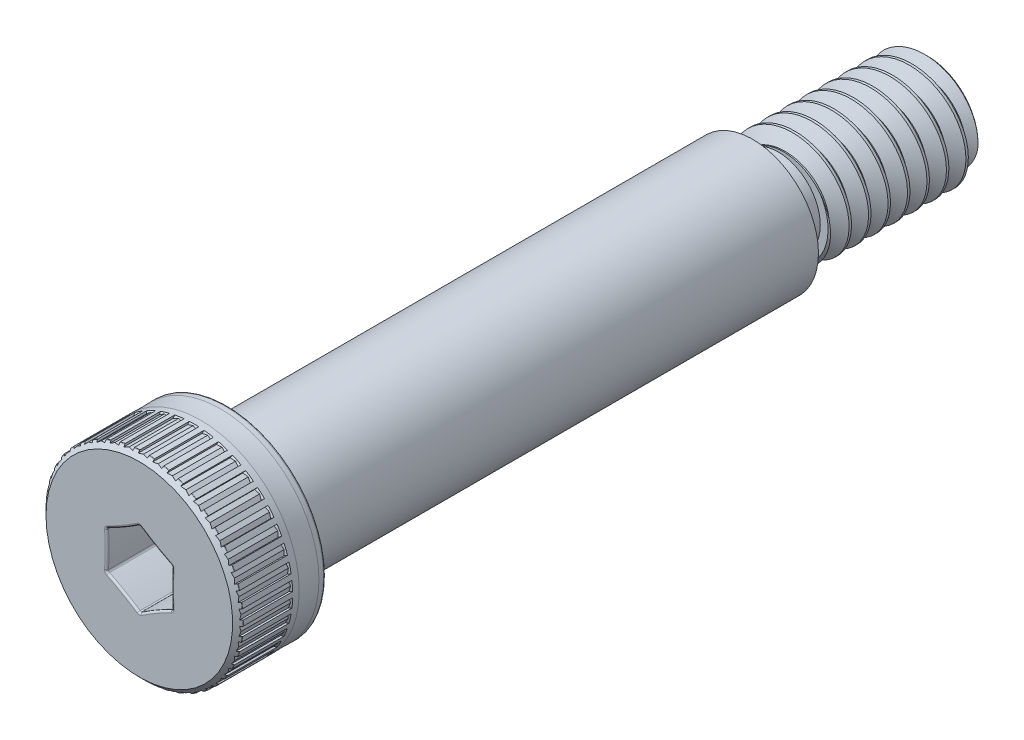
from build123d import *

# Parameters (mm, degrees)
SKETCH4_W             = 1.5875
SKETCH4_H             = 0.47625
SKETCH4_W_2           = 1.834444444
SKETCH4_H_2           = 0.916543552
CHAMFER1_SIZE         = 0.47625
FILLET1_R             = 0.28575
FILLET2_R             = 0.282222222
CHAMFER2_SIZE         = 0.352777778
CHAMFER3_SIZE         = 0.381
CUT_EXTRUDE1_DEPTH    = 3.9751
FILLET4_R             = 0.142875
DELETEFACE1_START     = -39.934444444
DELETEFACE1_OUTLINE_W = 10
DELETEFACE1_OUTLINE_H = 10
DELETEFACE1_OUTLINE_R = 3.058556448
DELETEFACE1_DEPTH     = 0.282222322
CUT_SWEEP1_PITCH      = 1.411111111
CUT_EXTRUDE2_REACH    = 60.036
CIRPATTERN1_COUNT     = 42
FILLET5_R             = 0.0508


# Read off the part's stored shape, not the designer's step: DeleteFace1, CirPattern2
with BuildPart() as part:
    # Sketch3 → Revolve1 (revolve)
    with BuildSketch(Plane(origin=(0, 0, 0), x_dir=(0, 0, -1), z_dir=(1, 0, 0)), mode=Mode.PRIVATE) as revolve1_sk:
        Polygon((-6.35, 7.14375), (0, 7.14375), (0, 4.7625), (38.1, 4.7625), (38.1, 3.9751), (50.8, 3.9751), (50.8, 0), (-6.35, 0), align=None)
    revolve(revolve1_sk.sketch.rotate(Axis((0, 0, 6.35), (0, 0, -1)), 90), axis=Axis((0, 0, 6.35), (0, 0, -1)))

    # Sketch4 → Cut-Revolve1 (revolve, cut)
    with BuildSketch(Plane(origin=(0, 0, 0), x_dir=(0, 0, -1), z_dir=(1, 0, 0)), mode=Mode.PRIVATE) as cut_revolve1_sk:
        with Locations((0.79375, 4.524375)):
            Rectangle(SKETCH4_W, SKETCH4_H)
        with Locations((39.017222222, 3.516828224)):
            Rectangle(SKETCH4_W_2, SKETCH4_H_2)
    revolve(cut_revolve1_sk.sketch.rotate(Axis((0, 0, 6.35), (0, 0, -1)), 90), axis=Axis((0, 0, 6.35), (0, 0, -1)), mode=Mode.SUBTRACT)

    # Chamfer1
    chamfer1_edges = [part.edges().sort_by_distance(p)[0] for p in [
        (-4.28625, 0, -1.5875),
    ]]
    chamfer(chamfer1_edges, length=CHAMFER1_SIZE - 0.0001)  # a hair under: the kernel refuses the full size

    # Fillet1
    fillet1_edges = [part.edges().sort_by_distance(p)[0] for p in [
        (-4.28625, 0, 0),
    ]]
    fillet(fillet1_edges, radius=FILLET1_R)

    # Fillet2
    fillet2_edges = [part.edges().sort_by_distance(p)[0] for p in [
        (-3.058556448, 0, -38.1),
        (-3.058556448, 0, -39.934444444),
    ]]
    fillet(fillet2_edges, radius=FILLET2_R)

    # Chamfer2
    chamfer2_edges = [part.edges().sort_by_distance(p)[0] for p in [
        (-3.9751, 0, -39.934444444),
        (-3.9751, 0, -50.8),
    ]]
    chamfer(chamfer2_edges, length=CHAMFER2_SIZE)

    # Chamfer3
    chamfer3_edges = [part.edges().sort_by_distance(p)[0] for p in [
        (-7.14375, 0, 6.35),
    ]]
    chamfer(chamfer3_edges, length=CHAMFER3_SIZE)

    # Sketch5 → Cut-Extrude1 (cut)
    with BuildSketch(Plane.XY.offset(6.35)):
        with BuildLine():
            ThreePointArc((2.38125, 1.374815329), (1.1668125, 2.020978533), (0, 2.749630657))
            ThreePointArc((0, 2.749630657), (-1.1668125, 2.020978533), (-2.38125, 1.374815329))
            ThreePointArc((-2.38125, 1.374815329), (-2.333625, 0), (-2.38125, -1.374815329))
            ThreePointArc((-2.38125, -1.374815329), (-1.1668125, -2.020978533), (0, -2.749630657))
            ThreePointArc((0, -2.749630657), (1.1668125, -2.020978533), (2.38125, -1.374815329))
            ThreePointArc((2.38125, -1.374815329), (2.333625, 0), (2.38125, 1.374815329))
        make_face()
    extrude(amount=-CUT_EXTRUDE1_DEPTH, mode=Mode.SUBTRACT)

    # Fillet4
    fillet4_edges = [part.edges().sort_by_distance(p)[0] for p in [
        (2.333625, 0, 2.3749),
        (2.38125, 1.374815329, 4.36245),
        (1.1668125, -2.020978533, 2.3749),
        (2.38125, -1.374815329, 4.36245),
        (-1.1668125, -2.020978533, 2.3749),
        (0, -2.749630657, 4.36245),
        (-2.333625, 0, 2.3749),
        (-2.38125, -1.374815329, 4.36245),
        (-1.1668125, 2.020978533, 2.3749),
        (-2.38125, 1.374815329, 4.36245),
        (1.1668125, 2.020978533, 2.3749),
        (0, 2.749630657, 4.36245),
        (2.333625, 0, 6.35),
        (1.1668125, 2.020978533, 6.35),
        (-1.1668125, 2.020978533, 6.35),
        (-2.333625, 0, 6.35),
        (-1.1668125, -2.020978533, 6.35),
        (1.1668125, -2.020978533, 6.35),
        (-7.14375, 0, 0),
    ]]
    fillet(fillet4_edges, radius=FILLET4_R)

    # DeleteFace1 outline → DeleteFace1 (cut)
    with BuildSketch(Plane.XY.offset(DELETEFACE1_START)):
        Rectangle(DELETEFACE1_OUTLINE_W, DELETEFACE1_OUTLINE_H)
        Circle(DELETEFACE1_OUTLINE_R, mode=Mode.SUBTRACT)
    extrude(amount=DELETEFACE1_DEPTH, mode=Mode.SUBTRACT)

    # Cut-Sweep1: the profile of Sketch7 profile screwed along a right-hand helix of 8.48 turns, 8 arcs to a turn; built about Z, then put on its axis
    cut_sweep1_z = Axis((0, 0, 0), (0, 0, 1))
    cut_sweep1_corners = [(4.051478629, 0, 0.044097222), (4.051478629, 0, -1.278819444), (3.058256448, 0, -0.70538235), (3.058256448, 0, -0.529339872)]
    with BuildLine(mode=Mode.PRIVATE) as cut_sweep1_profile:
        Line(cut_sweep1_corners[0], cut_sweep1_corners[1])
        Line(cut_sweep1_corners[1], cut_sweep1_corners[2])
        Line(cut_sweep1_corners[2], cut_sweep1_corners[3])
        Line(cut_sweep1_corners[3], cut_sweep1_corners[0])
    cut_sweep1_cap = Face(cut_sweep1_profile.wire())
    cut_sweep1_turn_angles = [0, 22.5, 45, 67.5, 90, 112.5, 135, 157.5, 180, 202.5, 225, 247.5, 270, 292.5, 315, 337.5, 360]
    cut_sweep1_turn_weights = [1, 0.9238795325112867, 1, 0.9238795325112867, 1, 0.9238795325112867, 1, 0.9238795325112867, 1, 0.9238795325112867, 1, 0.9238795325112867, 1, 0.9238795325112867, 1, 0.9238795325112867, 1]
    cut_sweep1_turn_rails = [Edge.make_bspline([Vector(p[0], p[1], 0).rotate(cut_sweep1_z, cut_sweep1_turn_angles[k]) / cut_sweep1_turn_weights[k] + Vector(0, 0, p[2] + CUT_SWEEP1_PITCH * cut_sweep1_turn_angles[k] / 360) for k in range(17)], [0, 0, 0, 1, 1, 2, 2, 3, 3, 4, 4, 5, 5, 6, 6, 7, 7, 8, 8, 8], 2, cut_sweep1_turn_weights) for p in cut_sweep1_corners]
    cut_sweep1_turn_sides = [Face.make_surface_from_curves(cut_sweep1_turn_rails[p[0]], cut_sweep1_turn_rails[p[1]]) for p in [(0, 1), (1, 2), (2, 3), (3, 0)]]
    cut_sweep1_last_angles = [2880, 2902.5, 2925, 2947.5, 2970, 2992.5, 3015, 3033.899999987, 3052.799999974]
    cut_sweep1_last_weights = [1, 0.9238795325112867, 1, 0.9238795325112867, 1, 0.9238795325112867, 1, 0.9460853589022572, 1]
    cut_sweep1_last_rails = [Edge.make_bspline([Vector(p[0], p[1], 0).rotate(cut_sweep1_z, cut_sweep1_last_angles[k]) / cut_sweep1_last_weights[k] + Vector(0, 0, p[2] + CUT_SWEEP1_PITCH * cut_sweep1_last_angles[k] / 360) for k in range(9)], [0, 0, 0, 1, 1, 2, 2, 3, 3, 4, 4, 4], 2, cut_sweep1_last_weights) for p in cut_sweep1_corners]
    cut_sweep1_last_sides = [Face.make_surface_from_curves(cut_sweep1_last_rails[p[0]], cut_sweep1_last_rails[p[1]]) for p in [(0, 1), (1, 2), (2, 3), (3, 0)]]
    cut_sweep1 = Plane(origin=(0, 0, -50.8), x_dir=(0, 1, 0), z_dir=(0, 0, 1)) * Solid(Shell([*[p.moved(Location((0, 0, CUT_SWEEP1_PITCH * i))) for i in range(8) for p in cut_sweep1_turn_sides], *cut_sweep1_last_sides, cut_sweep1_cap, cut_sweep1_cap.rotate(cut_sweep1_z, 3052.799999974).moved(Location((0, 0, CUT_SWEEP1_PITCH * 3052.799999974 / 360)))]))
    add(cut_sweep1, mode=Mode.SUBTRACT)

    # Cut-Extrude2: up to this plane
    cut_extrude2_end = Plane(origin=(0, 8.546915019, 0.978084981), z_dir=(0, 0.707106781186546, 0.7071067811865491))
    # Sketch8 → Cut-Extrude2 (cut, up to the surface)
    with BuildSketch(Plane.XY.offset(6.35), mode=Mode.PRIVATE) as cut_extrude2_sk1:
        Polygon((-0.3429, 7.14375), (0.3429, 7.14375), (0.328483903, 7.00659), (0, 7.07517), (-0.328483903, 7.00659), align=None)
    cut_extrude2_tool1 = split(extrude(cut_extrude2_sk1.sketch, amount=-CUT_EXTRUDE2_REACH, mode=Mode.PRIVATE), bisect_by=cut_extrude2_end, keep=Keep.BOTH, mode=Mode.PRIVATE)
    cut_extrude2 = cut_extrude2_tool1.solids().sort_by_distance((0, 7.090627, 6.35))[0]
    add(cut_extrude2, mode=Mode.SUBTRACT)

    # CirPattern1: Cut-Extrude2 ×42 about axis
    cirpattern1_axis = Axis((0, 0, 0), (0, 0, 1))
    for i in range(1, CIRPATTERN1_COUNT):
        add(cut_extrude2.rotate(cirpattern1_axis, i * 360 / CIRPATTERN1_COUNT), mode=Mode.SUBTRACT)

    # Fillet5
    fillet5_edges = [part.edges().sort_by_distance(p)[0] for p in [
        (0.533853106, 7.123774626, 5.969),
    ]]
    fillet(fillet5_edges, radius=FILLET5_R)

    # CirPattern2 outline → CirPattern2 (revolve, cut)
    with BuildSketch(Plane.XZ):
        with BuildLine():
            ThreePointArc((7.128871024, 5.983878976), (7.13988308, 5.96739827), (7.14375, 5.947957951))
            Line((7.14375, 5.947957951), (7.14375, 5.983878976))
            Line((7.14375, 5.983878976), (7.128871024, 5.983878976))
        make_face()
    revolve(axis=Axis((0, 0, 0), (0, 0, 1)), mode=Mode.SUBTRACT)

    # Sketch11 → Cut-Revolve6 (revolve, cut)
    with BuildSketch(Plane(origin=(0, 0, 0), x_dir=(0, 0, -1), z_dir=(1, 0, 0)), mode=Mode.PRIVATE) as cut_revolve6_sk:
        with BuildLine():
            Line((-1.905, 7.14375), (-0.47625, 7.14375))
            ThreePointArc((-0.47625, 7.14375), (-1.190625, 7.12597), (-1.905, 7.14375))
        make_face()
    revolve(cut_revolve6_sk.sketch.rotate(Axis((0, 0, 6.35), (0, 0, -1)), 90), axis=Axis((0, 0, 6.35), (0, 0, -1)), mode=Mode.SUBTRACT)


solid = part.part
